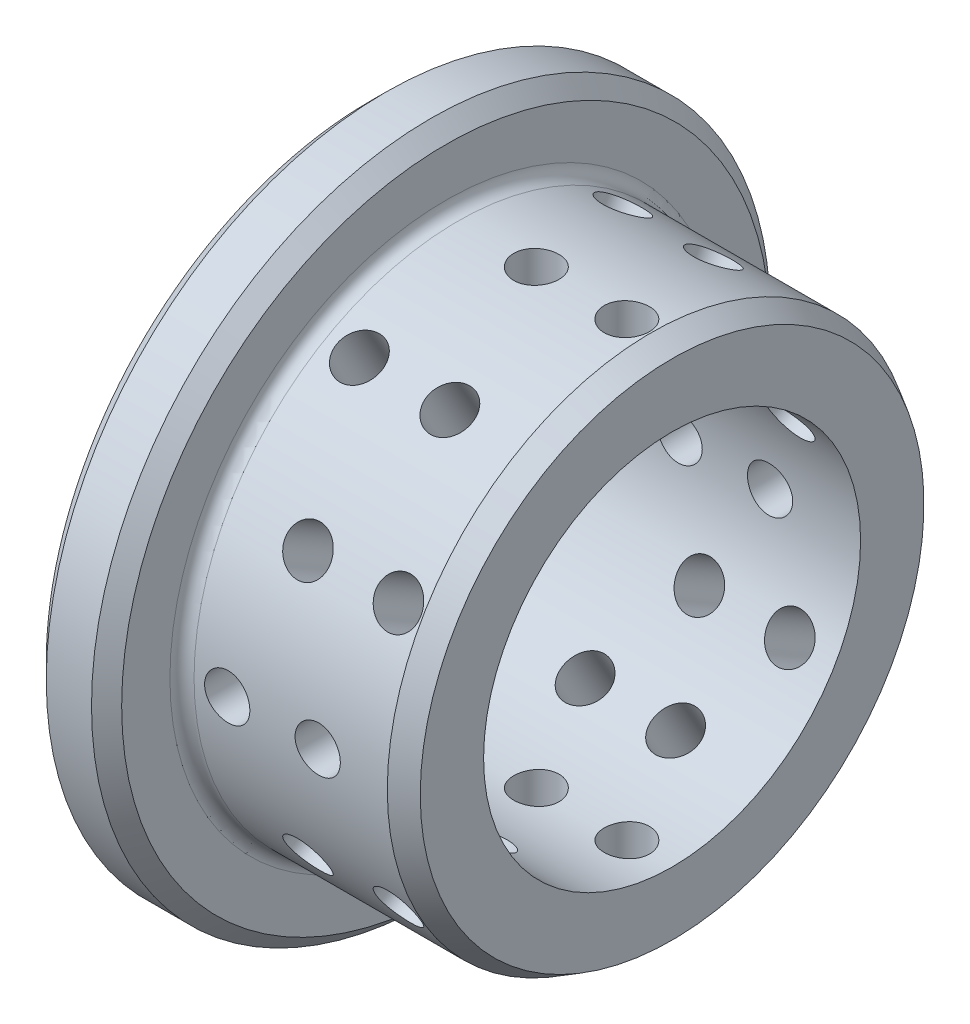
from build123d import *

# Parameters (mm, degrees)
CUT_EXTRUDE1_DEPTH      = 38.583240946
CUT_EXTRUDE1_DEPTH_BACK = 4
SKETCH2_R               = 1.5
SKETCH3_R               = 1.5
CUT_EXTRUDE2_DEPTH      = 4
CIRPATTERN1_COUNT       = 6
CUT_EXTRUDE3_REACH      = 39.583
CUT_EXTRUDE3_END_RADIUS = 17.5
SKETCH4_R               = 1.5
CUT_EXTRUDE4_REACH      = 39.583
CUT_EXTRUDE4_END_RADIUS = 17.5
SKETCH5_R               = 1.5
CIRPATTERN2_COUNT       = 6
CHAMFER1_SIZE           = 0.8
CHAMFER1_SIZE2          = 1.385640646
FILLET1_R               = 0.8
CHAMFER2_SIZE           = 1


with BuildPart() as part:
    # Sketch1 → Revolve1 (revolve)
    with BuildSketch(Plane.XY, mode=Mode.PRIVATE) as revolve1_sk:
        Polygon((0, 12.5), (0, 22.5), (5, 22.5), (5, 17.5), (20, 17.5), (20, 12.5), align=None)
    revolve(revolve1_sk.sketch.rotate(Axis((0, 0, 0), (1, 0, 0)), 90), axis=Axis((0, 0, 0), (1, 0, 0)))

    # Sketch2 → Cut-Extrude1 (cut, two sides: drawn at the far end of the back side and taken through both)
    with BuildSketch(Plane.ZY.offset(-CUT_EXTRUDE1_DEPTH_BACK)):
        with Locations(Location((0, 20, 0), (0, 0, 180))):
            Circle(SKETCH2_R)
        with Locations(Location((17.320508076, 10, 0), (0, 0, 180))):
            Circle(SKETCH2_R)
        with Locations(Location((17.320508076, -10, 0), (0, 0, 180))):
            Circle(SKETCH2_R)
        with Locations(Location((0, -20, 0), (0, 0, 180))):
            Circle(SKETCH2_R)
        with Locations(Location((-17.320508076, -10, 0), (0, 0, 180))):
            Circle(SKETCH2_R)
        with Locations(Location((-17.320508076, 10, 0), (0, 0, 180))):
            Circle(SKETCH2_R)
    extrude(amount=CUT_EXTRUDE1_DEPTH + CUT_EXTRUDE1_DEPTH_BACK, mode=Mode.SUBTRACT)

    # Sketch3 → Cut-Extrude2 (cut)
    with BuildSketch(Plane.ZY):
        with Locations((17, 0)):
            Circle(SKETCH3_R)
    cut_extrude2 = extrude(amount=-CUT_EXTRUDE2_DEPTH, mode=Mode.SUBTRACT)

    # CirPattern1: Cut-Extrude2 ×6 about axis
    cirpattern1_axis = Axis((0, 0, 0), (1, 0, 0))
    for i in range(1, CIRPATTERN1_COUNT):
        add(cut_extrude2.rotate(cirpattern1_axis, i * 360 / CIRPATTERN1_COUNT), mode=Mode.SUBTRACT)

    # Cut-Extrude3: up to this cylinder (the profile starts inside it)
    cut_extrude3_end = Plane(origin=(14, 0, 0), z_dir=(-1, 0, 0)) * Cylinder(CUT_EXTRUDE3_END_RADIUS, 121.166, mode=Mode.PRIVATE)
    # Sketch4 → Cut-Extrude3 (cut, up to the surface)
    with BuildSketch(Plane(origin=(0, 0, 0), x_dir=(1, 0, 0), z_dir=(0, 1, 0)), mode=Mode.PRIVATE) as cut_extrude3_sk1:
        with Locations(Location((11, 0, 0), (0, 0, 270))):
            Circle(SKETCH4_R)
    cut_extrude3_tool1 = extrude(cut_extrude3_sk1.sketch, amount=-CUT_EXTRUDE3_REACH, mode=Mode.PRIVATE) & cut_extrude3_end
    # Sketch4 → Cut-Extrude3 (cut, up to the surface)
    with BuildSketch(Plane(origin=(0, 0, 0), x_dir=(1, 0, 0), z_dir=(0, 1, 0)), mode=Mode.PRIVATE) as cut_extrude3_sk2:
        with Locations(Location((17, 0, 0), (0, 0, 270))):
            Circle(SKETCH4_R)
    cut_extrude3_tool2 = extrude(cut_extrude3_sk2.sketch, amount=-CUT_EXTRUDE3_REACH, mode=Mode.PRIVATE) & cut_extrude3_end
    cut_extrude3 = cut_extrude3_tool1.solids().sort_by_distance((11, 0, 0))[0] + cut_extrude3_tool2.solids().sort_by_distance((17, 0, 0))[0]
    add(cut_extrude3, mode=Mode.SUBTRACT)

    # Cut-Extrude4: up to this cylinder (the profile starts inside it)
    cut_extrude4_end = Plane(origin=(11, 0, 0), z_dir=(-1, 0, 0)) * Cylinder(CUT_EXTRUDE4_END_RADIUS, 121.166, mode=Mode.PRIVATE)
    # Sketch5 → Cut-Extrude4 (cut, up to the surface)
    with BuildSketch(Plane.XY, mode=Mode.PRIVATE) as cut_extrude4_sk1:
        with Locations((8, 0)):
            Circle(SKETCH5_R)
    cut_extrude4_tool1 = extrude(cut_extrude4_sk1.sketch, amount=-CUT_EXTRUDE4_REACH, mode=Mode.PRIVATE) & cut_extrude4_end
    # Sketch5 → Cut-Extrude4 (cut, up to the surface)
    with BuildSketch(Plane.XY, mode=Mode.PRIVATE) as cut_extrude4_sk2:
        with Locations((14, 0)):
            Circle(SKETCH5_R)
    cut_extrude4_tool2 = extrude(cut_extrude4_sk2.sketch, amount=-CUT_EXTRUDE4_REACH, mode=Mode.PRIVATE) & cut_extrude4_end
    cut_extrude4 = cut_extrude4_tool1.solids().sort_by_distance((8, 0, 0))[0] + cut_extrude4_tool2.solids().sort_by_distance((14, 0, 0))[0]
    add(cut_extrude4, mode=Mode.SUBTRACT)

    # CirPattern2: Cut-Extrude3, Cut-Extrude4 ×6 about axis
    cirpattern2_axis = Axis((0, 0, 0), (-1, 0, 0))
    add([cut_extrude3.rotate(cirpattern2_axis, i * 360 / CIRPATTERN2_COUNT) for i in range(1, CIRPATTERN2_COUNT)], mode=Mode.SUBTRACT)
    add([cut_extrude4.rotate(cirpattern2_axis, i * 360 / CIRPATTERN2_COUNT) for i in range(1, CIRPATTERN2_COUNT)], mode=Mode.SUBTRACT)

    # Chamfer1
    chamfer1_edges = [part.edges().sort_by_distance(p)[0] for p in [
        (20, 0, -17.5),
    ]]
    chamfer1_side = [part.faces().sort_by_distance(p)[0] for p in [
        (20, 0, -17.005025253),
    ]]
    chamfer(chamfer1_edges, length=CHAMFER1_SIZE, length2=CHAMFER1_SIZE2, reference=chamfer1_side[0])

    # Fillet1
    fillet1_edges = [part.edges().sort_by_distance(p)[0] for p in [
        (5, 0, -17.5),
    ]]
    fillet(fillet1_edges, radius=FILLET1_R)

    # Chamfer2
    chamfer2_edges = [part.edges().sort_by_distance(p)[0] for p in [
        (5, 0, -22.5),
        (0, 0, -22.5),
    ]]
    chamfer(chamfer2_edges, length=CHAMFER2_SIZE - 0.0001)  # a hair under: the kernel refuses the full size


solid = part.part
